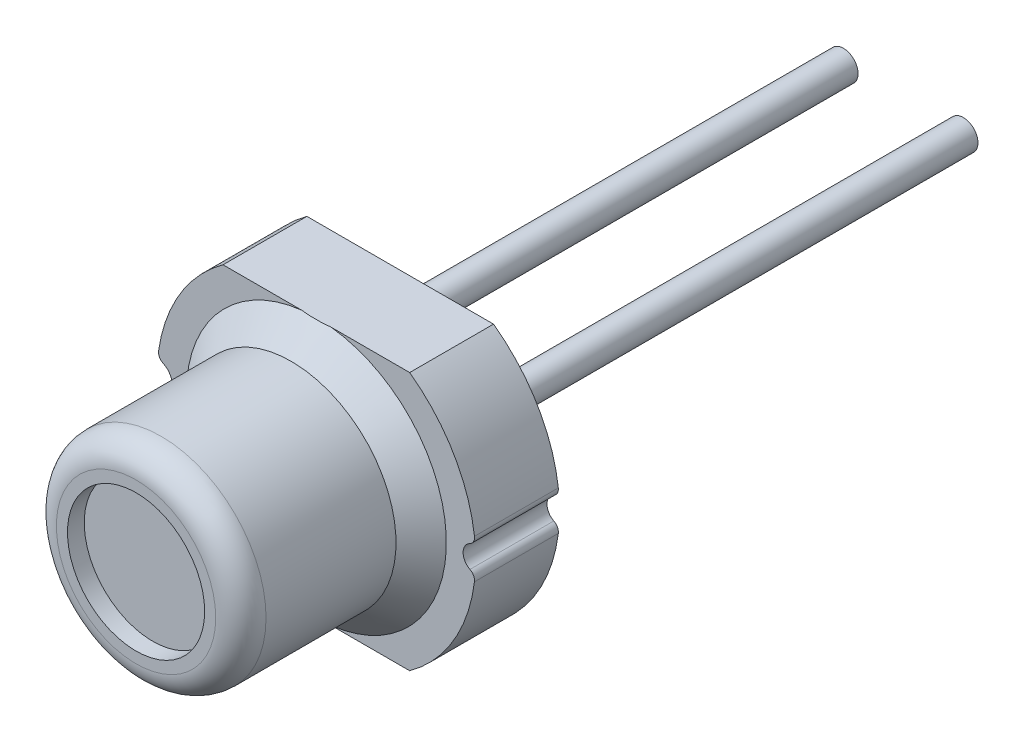
from build123d import *

# Parameters (mm, degrees)
BOSS_EXTRUDE1_DEPTH = 1
SKETCH3_R           = 1.25
BOSS_EXTRUDE2_DEPTH = 2.15
CHAMFER1_SIZE       = 0.3
FILLET1_R           = 0.3
SKETCH4_R           = 0.817963918
CUT_EXTRUDE1_DEPTH  = 0.2
SKETCH5_R           = 0.175
BOSS_EXTRUDE3_DEPTH = 6
SKETCH6_R           = 0.340201154
BOSS_EXTRUDE4_DEPTH = 0.2


with BuildPart() as part:
    # Sketch1 → Boss-Extrude1 (new body)
    with BuildSketch(Plane.XY):
        with BuildLine():
            Line((-1.112834219, 1.54), (1.112834219, 1.54))
            ThreePointArc((1.112834219, 1.54), (1.63498089, 0.967903657), (1.885416667, 0.2349553))
            ThreePointArc((1.885416667, 0.2349553), (1.874554764, 0.175784903), (1.831710526, 0.133553539))
            ThreePointArc((1.831710526, 0.133553539), (1.75, 0), (1.831710526, -0.133553539))
            ThreePointArc((1.831710526, -0.133553539), (1.874554764, -0.175784903), (1.885416667, -0.2349553))
            ThreePointArc((1.885416667, -0.2349553), (1.63498089, -0.967903657), (1.112834219, -1.54))
            Line((1.112834219, -1.54), (-1.112834219, -1.54))
            ThreePointArc((-1.112834219, -1.54), (-1.626419084, -0.982222462), (-1.881, -0.268027984))
            ThreePointArc((-1.881, -0.268027984), (-1.869896042, -0.206231776), (-1.824142857, -0.163235088))
            ThreePointArc((-1.824142857, -0.163235088), (-1.72, 0), (-1.824142857, 0.163235088))
            ThreePointArc((-1.824142857, 0.163235088), (-1.869896042, 0.206231776), (-1.881, 0.268027984))
            ThreePointArc((-1.881, 0.268027984), (-1.626419084, 0.982222462), (-1.112834219, 1.54))
        make_face()
    extrude(amount=BOSS_EXTRUDE1_DEPTH)

    # Sketch3 → Boss-Extrude2 (add)
    with BuildSketch(Plane.XY.offset(1)):
        with Locations(Location((0, 0, 0), (0, 0, 180))):
            Circle(SKETCH3_R)
    extrude(amount=BOSS_EXTRUDE2_DEPTH)

    # Chamfer1
    # the kernel refuses this chamfer: 0.3 mm, written as the material it adds along each edge
    with BuildSketch(Plane(origin=(0, 0, 1), x_dir=(-1, 0, 0), z_dir=(0, 1, 0))) as chamfer1_piece_1_section:
        Polygon((1.25 + CHAMFER1_SIZE, 0), (1.25, CHAMFER1_SIZE), (1.25, 0), align=None)
    chamfer1_piece_1 = revolve(axis=Axis((0, 0, 1), (0, 0, 1)), mode=Mode.PRIVATE)
    chamfer1_piece_1 = split(chamfer1_piece_1, bisect_by=Plane(origin=(1.394706395, -1.54, 1.144706395), z_dir=(0, 1, 0)), keep=Keep.TOP, mode=Mode.PRIVATE)
    chamfer1_piece_1 = split(chamfer1_piece_1, bisect_by=Plane(origin=(1.394706395, 1.54, 1.144706395), z_dir=(0, -1, 0)), keep=Keep.TOP, mode=Mode.PRIVATE)
    add(chamfer1_piece_1)

    # Fillet1
    fillet1_edges = [part.edges().sort_by_distance(p)[0] for p in [
        (1.25, 0, 3.15),
    ]]
    fillet(fillet1_edges, radius=FILLET1_R)

    # Sketch4 → Cut-Extrude1 (cut)
    with BuildSketch(Plane.XY.offset(3.15)):
        Circle(SKETCH4_R)
    extrude(amount=-CUT_EXTRUDE1_DEPTH, mode=Mode.SUBTRACT)

    # Sketch5 → Boss-Extrude3 (add)
    with BuildSketch(Plane.XY):
        with Locations((0.715, 0.3)):
            Circle(SKETCH5_R)
        with Locations((-0.715, 0.3)):
            Circle(SKETCH5_R)
        with Locations((0, -0.415)):
            Circle(SKETCH5_R)
    extrude(amount=-BOSS_EXTRUDE3_DEPTH)

    # Sketch6 → Boss-Extrude4 (add)
    with BuildSketch(Plane(origin=(0, 0, 0), x_dir=(-1, 0, 0), z_dir=(0, 0, -1))):
        with Locations(Location((0, -0.415, 0), (0, 0, 180))):
            Circle(SKETCH6_R)
    extrude(amount=BOSS_EXTRUDE4_DEPTH)


solid = part.part
